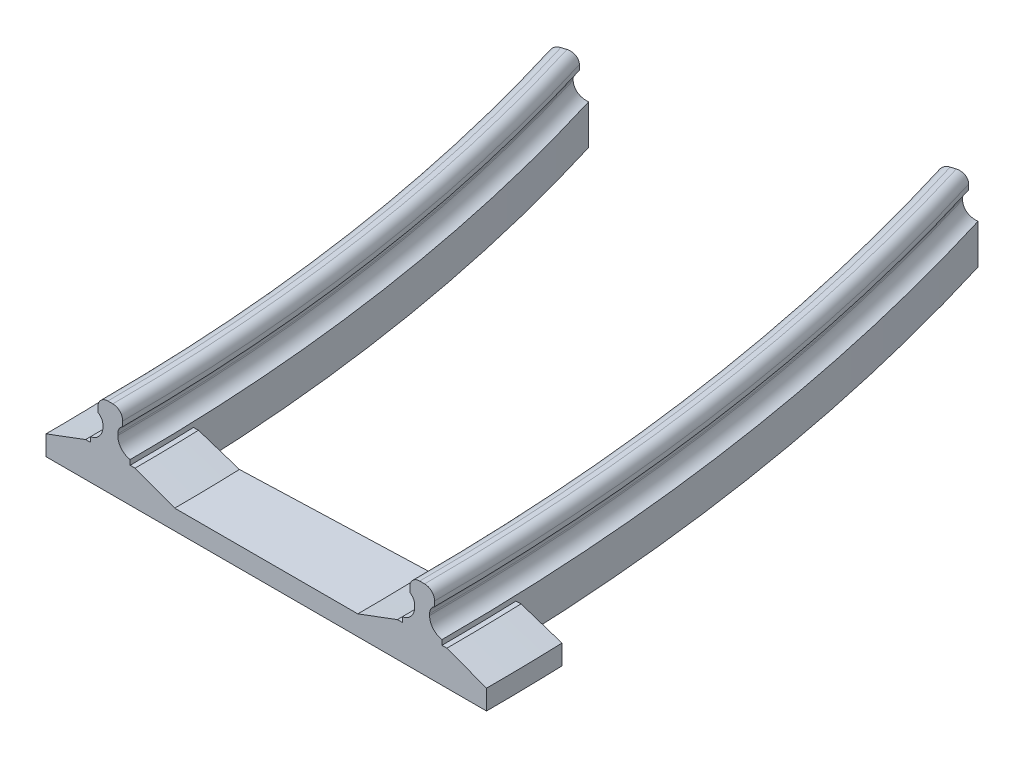
from build123d import *

# Parameters (mm, degrees)
SKETCH_1_W          = 4
SKETCH_1_H          = 21
SKETCH_1_H_2        = 8
EXTRUDE_1_DEPTH     = 4
SKETCH_1_7_W        = 44.5
SKETCH_1_7_H        = 8
EXTRUDE_2_DEPTH     = 3.5
SKETCH_2_W          = 18.5
SKETCH_2_H          = 1.5
CUT_EXTRUDE_1_DEPTH = 37.7704025
SKETCH_2_3_W        = 2.5
SKETCH_2_3_H        = 1.5
EXTRUDE_4_DEPTH     = 29
FILLET_1_R          = 1
FILLET_2_R          = 1.5
FILLET_3_R          = 1
REVOLVE_2_ANGLE     = 17
CUT_EXTRUDE_5_DEPTH = 70.125096927
REVOLVE_1_ANGLE     = 2


with BuildPart() as part:
    # 草图1 → 凸台-拉伸1 (new body)
    with BuildSketch(Plane(origin=(0, 0, 0), x_dir=(1, 0, 0), z_dir=(0, 1, 0))):
        with Locations((-15.75, -4)):
            Rectangle(SKETCH_1_W, SKETCH_1_H)
        with Locations((15.75, -4)):
            Rectangle(SKETCH_1_W, SKETCH_1_H)
        with Locations((15.75, 10.5)):
            Rectangle(SKETCH_1_W, SKETCH_1_H_2)
        with Locations((-15.75, 10.5)):
            Rectangle(SKETCH_1_W, SKETCH_1_H_2)
    extrude(amount=EXTRUDE_1_DEPTH)

    # 草图1<7> → 凸台-拉伸2 (add)
    with BuildSketch(Plane(origin=(0, 0, 0), x_dir=(1, 0, 0), z_dir=(0, 1, 0))):
        with Locations((0, 10.5)):
            Rectangle(SKETCH_1_7_W, SKETCH_1_7_H)
    extrude(amount=EXTRUDE_2_DEPTH)

    # 草图2 → 切除-拉伸1 (cut, through all)
    with BuildSketch(Plane(origin=(0, 0, -14.5), x_dir=(-1, 0, 0), z_dir=(0, 0, -1))):
        with Locations((0, 2.75)):
            Rectangle(SKETCH_2_W, SKETCH_2_H)
        Polygon((13.25, 3.5), (9.25, 3.5), (9.25, 2), align=None)
        Polygon((-9.25, 3.5), (-13.25, 3.5), (-9.25, 2), align=None)
        Polygon((-22.25, 3.5), (-22.25, 2), (-18.25, 3.5), align=None)
        Polygon((22.25, 3.5), (18.25, 3.5), (22.25, 2), align=None)
    extrude(amount=-CUT_EXTRUDE_1_DEPTH, mode=Mode.SUBTRACT)

    # 草图2<3> → 凸台-拉伸4 (add, through all)
    with BuildSketch(Plane(origin=(0, 0, -14.5), x_dir=(-1, 0, 0), z_dir=(0, 0, -1))):
        with Locations((-15.75, 7.25)):
            Rectangle(SKETCH_2_3_W, SKETCH_2_3_H)
        Polygon((-15, 6.5), (-16.5, 6.5), (-16.5, 4), (-15.75, 4), (-15, 4), align=None)
        with Locations((15.75, 7.25)):
            Rectangle(SKETCH_2_3_W, SKETCH_2_3_H)
        Polygon((16.5, 6.5), (15, 6.5), (15, 4), (15.75, 4), (16.5, 4), align=None)
    extrude(amount=-EXTRUDE_4_DEPTH)

    # 圆角1
    # the kernel refuses this fillet: 1 mm, written as the material it adds along each edge
    with BuildSketch(Plane(origin=(-16.5, 6.5, -14.5), x_dir=(-1, 0, 0), z_dir=(0, 0, 1)), Plane(origin=(15, 6.5, -14.5), x_dir=(-1, 0, 0), z_dir=(0, 0, 1))) as fillet_1_piece_1:
        with BuildLine():
            CenterArc((1, 0.866025404), FILLET_1_R, 180, 60)
            Line((0, 0.866025404), (-0.02, 0.866025404))
            Line((-0.02, 0.866025404), (-0.02, 0))
            Line((-0.02, 0), (0, -0.02))
            ThreePointArc((0, -0.02), (0.25, -0.02), (0.49, -0.017320508))
            Line((0.49, -0.017320508), (0.5, 0))
        make_face()
    extrude(amount=29)
    with BuildSketch(Plane(origin=(-15, 6.5, -14.5), x_dir=(0, -1, 0), z_dir=(0, 0, 1)), Plane(origin=(16.5, 6.5, -14.5), x_dir=(0, -1, 0), z_dir=(0, 0, 1))) as fillet_1_piece_2:
        with BuildLine():
            CenterArc((0.866025404, 1), FILLET_1_R, 210, 60)
            Line((0, 0.5), (-0.017320508, 0.49))
            ThreePointArc((-0.017320508, 0.49), (-0.02, 0.25), (-0.02, 0))
            Line((-0.02, 0), (0, -0.02))
            Line((0, -0.02), (0.866025404, -0.02))
            Line((0.866025404, -0.02), (0.866025404, 0))
        make_face()
    extrude(amount=29)

    # 圆角2
    # the kernel refuses this fillet: 1.5 mm, written as the material it adds along each edge
    with BuildSketch(Plane(origin=(16.5, 4, -14.5), x_dir=(1, 0, 0), z_dir=(0, 0, 1))) as fillet_2_piece_1:
        with BuildLine():
            CenterArc((1.5, 1.479019946), FILLET_2_R, 180, 80.405931773)
            Line((0, 1.479019946), (-0.03, 1.479019946))
            Line((-0.03, 1.479019946), (-0.03, 0))
            Line((-0.03, 0), (0, -0.03))
            ThreePointArc((0, -0.03), (0.625, -0.03), (1.245, -0.029580399))
            Line((1.245, -0.029580399), (1.25, 0))
        make_face()
    extrude(amount=29)
    with BuildSketch(Plane(origin=(15, 4, -14.5), x_dir=(0, 1, 0), z_dir=(0, 0, 1)), Plane(origin=(-16.5, 4, -14.5), x_dir=(0, 1, 0), z_dir=(0, 0, 1))) as fillet_2_piece_2:
        with BuildLine():
            CenterArc((1.479019946, 1.5), FILLET_2_R, 189.594068227, 80.405931773)
            Line((0, 1.25), (-0.029580399, 1.245))
            ThreePointArc((-0.029580399, 1.245), (-0.03, 0.625), (-0.03, 0))
            Line((-0.03, 0), (0, -0.03))
            Line((0, -0.03), (1.479019946, -0.03))
            Line((1.479019946, -0.03), (1.479019946, 0))
        make_face()
    extrude(amount=29)
    with BuildSketch(Plane(origin=(-15, 4, -14.5), x_dir=(0, 1, 0), z_dir=(0, 0, 1))) as fillet_2_piece_3:
        with BuildLine():
            CenterArc((1.479019946, -1.5), FILLET_2_R, 90, 80.405931773)
            Line((0, -1.25), (-0.029580399, -1.245))
            ThreePointArc((-0.029580399, -1.245), (-0.03, -0.625), (-0.03, 0))
            Line((-0.03, 0), (0, 0.03))
            Line((0, 0.03), (1.479019946, 0.03))
            Line((1.479019946, 0.03), (1.479019946, 0))
        make_face()
    extrude(amount=29)

    # 圆角3
    fillet_3_edges = [part.edges().sort_by_distance(p)[0] for p in [
        (14.5, 8, 0),
        (17, 8, 0),
        (-17, 8, 0),
        (-14.5, 8, 0),
    ]]
    fillet(fillet_3_edges, radius=FILLET_3_R)

    # 草图7 → 旋转2 (revolve)
    with BuildSketch(Plane(origin=(0, 0, -14.5), x_dir=(-1, 0, 0), z_dir=(0, 0, -1))):
        with BuildLine():
            Line((-17.75, 3.5), (-17.75, 0))
            Line((-17.75, 0), (-13.75, 0))
            Line((-13.75, 0), (-13.75, 3.5))
            Line((-13.75, 3.5), (-13.75, 4))
            ThreePointArc((-13.75, 4), (-14.645643924, 4.510774109), (-15, 5.479019946))
            Line((-15, 5.479019946), (-15, 5.633974596))
            ThreePointArc((-15, 5.633974596), (-14.866025404, 6.133974596), (-14.5, 6.5))
            Line((-14.5, 6.5), (-14.5, 7))
            ThreePointArc((-14.5, 7), (-14.792893219, 7.707106781), (-15.5, 8))
            Line((-15.5, 8), (-16, 8))
            ThreePointArc((-16, 8), (-16.707106781, 7.707106781), (-17, 7))
            Line((-17, 7), (-17, 6.5))
            ThreePointArc((-17, 6.5), (-16.633974596, 6.133974596), (-16.5, 5.633974596))
            Line((-16.5, 5.633974596), (-16.5, 5.479019946))
            ThreePointArc((-16.5, 5.479019946), (-16.854356076, 4.510774109), (-17.75, 4))
            Line((-17.75, 4), (-17.75, 3.5))
        make_face()
        with BuildLine():
            Line((13.75, 3.5), (13.75, 0))
            Line((13.75, 0), (17.75, 0))
            Line((17.75, 0), (17.75, 3.5))
            Line((17.75, 3.5), (17.75, 4))
            ThreePointArc((17.75, 4), (16.854356076, 4.510774109), (16.5, 5.479019946))
            Line((16.5, 5.479019946), (16.5, 5.633974596))
            ThreePointArc((16.5, 5.633974596), (16.633974596, 6.133974596), (17, 6.5))
            Line((17, 6.5), (17, 7))
            ThreePointArc((17, 7), (16.707106781, 7.707106781), (16, 8))
            Line((16, 8), (15.5, 8))
            ThreePointArc((15.5, 8), (14.792893219, 7.707106781), (14.5, 7))
            Line((14.5, 7), (14.5, 6.5))
            ThreePointArc((14.5, 6.5), (14.866025404, 6.133974596), (15, 5.633974596))
            Line((15, 5.633974596), (15, 5.479019946))
            ThreePointArc((15, 5.479019946), (14.645643924, 4.510774109), (13.75, 4))
            Line((13.75, 4), (13.75, 3.5))
        make_face()
    revolve(axis=Axis((-200, 10, -14.5), (0, 1, 0)), revolution_arc=REVOLVE_2_ANGLE)

    # 草图5<2> → 切除-拉伸5 (cut, through all)
    with BuildSketch(Plane(origin=(0, 0, -14.5), x_dir=(-1, 0, 0), z_dir=(0, 0, -1))):
        with BuildLine():
            Line((17, 6.5), (17, 7))
            ThreePointArc((17, 7), (16.707106781, 7.707106781), (16, 8))
            Line((16, 8), (15.5, 8))
            ThreePointArc((15.5, 8), (14.792893219, 7.707106781), (14.5, 7))
            Line((14.5, 7), (14.5, 6.5))
            ThreePointArc((14.5, 6.5), (14.866025404, 6.133974596), (15, 5.633974596))
            Line((15, 5.633974596), (15, 5.479019946))
            ThreePointArc((15, 5.479019946), (14.645643924, 4.510774109), (13.75, 4))
            Line((13.75, 4), (13.75, 3.5))
            Line((13.75, 3.5), (13.25, 3.5))
            Line((13.25, 3.5), (9.25, 2))
            Line((9.25, 2), (-9.25, 2))
            Line((-9.25, 2), (-13.25, 3.5))
            Line((-13.25, 3.5), (-13.75, 3.5))
            Line((-13.75, 3.5), (-13.75, 4))
            ThreePointArc((-13.75, 4), (-14.645643924, 4.510774109), (-15, 5.479019946))
            Line((-15, 5.479019946), (-15, 5.633974596))
            ThreePointArc((-15, 5.633974596), (-14.866025404, 6.133974596), (-14.5, 6.5))
            Line((-14.5, 6.5), (-14.5, 7))
            ThreePointArc((-14.5, 7), (-14.792893219, 7.707106781), (-15.5, 8))
            Line((-15.5, 8), (-16, 8))
            ThreePointArc((-16, 8), (-16.707106781, 7.707106781), (-17, 7))
            Line((-17, 7), (-17, 6.5))
            ThreePointArc((-17, 6.5), (-16.633974596, 6.133974596), (-16.5, 5.633974596))
            Line((-16.5, 5.633974596), (-16.5, 5.479019946))
            ThreePointArc((-16.5, 5.479019946), (-16.854356076, 4.510774109), (-17.75, 4))
            Line((-17.75, 4), (-17.75, 3.5))
            Line((-17.75, 3.5), (-18.25, 3.5))
            Line((-18.25, 3.5), (-22.25, 2))
            Line((-22.25, 2), (-22.25, 0))
            Line((-22.25, 0), (22.25, 0))
            Line((22.25, 0), (22.25, 2))
            Line((22.25, 2), (18.25, 3.5))
            Line((18.25, 3.5), (17.75, 3.5))
            Line((17.75, 3.5), (17.75, 4))
            ThreePointArc((17.75, 4), (16.854356076, 4.510774109), (16.5, 5.479019946))
            Line((16.5, 5.479019946), (16.5, 5.633974596))
            ThreePointArc((16.5, 5.633974596), (16.633974596, 6.133974596), (17, 6.5))
        make_face()
    extrude(amount=-CUT_EXTRUDE_5_DEPTH, mode=Mode.SUBTRACT)


with BuildPart() as cut_extrude_5_piece_1:
    # of the separate pieces the step leaves, piece 1, a body of its own (cut_extrude_5_pieces)
    add(part.part.solids().sort_by_distance((13.75, 0, -14.5))[0])



with BuildPart() as cut_extrude_5_piece_2:
    # of the separate pieces the step leaves, piece 2, a body of its own (cut_extrude_5_pieces)
    add(part.part.solids().sort_by_distance((-13.75, 4, -14.5))[0])


with BuildPart() as cut_extrude_5_piece_1_1:
    add(cut_extrude_5_piece_1.part)

    add(cut_extrude_5_piece_2.part)  # 旋转1 merges 切除-拉伸5 piece 2
    # 草图5 → 旋转1 (revolve)
    with BuildSketch(Plane(origin=(0, 0, -14.5), x_dir=(-1, 0, 0), z_dir=(0, 0, -1))):
        with BuildLine():
            Line((17, 6.5), (17, 7))
            ThreePointArc((17, 7), (16.707106781, 7.707106781), (16, 8))
            Line((16, 8), (15.5, 8))
            ThreePointArc((15.5, 8), (14.792893219, 7.707106781), (14.5, 7))
            Line((14.5, 7), (14.5, 6.5))
            ThreePointArc((14.5, 6.5), (14.866025404, 6.133974596), (15, 5.633974596))
            Line((15, 5.633974596), (15, 5.479019946))
            ThreePointArc((15, 5.479019946), (14.645643924, 4.510774109), (13.75, 4))
            Line((13.75, 4), (13.75, 3.5))
            Line((13.75, 3.5), (13.25, 3.5))
            Line((13.25, 3.5), (9.25, 2))
            Line((9.25, 2), (-9.25, 2))
            Line((-9.25, 2), (-13.25, 3.5))
            Line((-13.25, 3.5), (-13.75, 3.5))
            Line((-13.75, 3.5), (-13.75, 4))
            ThreePointArc((-13.75, 4), (-14.645643924, 4.510774109), (-15, 5.479019946))
            Line((-15, 5.479019946), (-15, 5.633974596))
            ThreePointArc((-15, 5.633974596), (-14.866025404, 6.133974596), (-14.5, 6.5))
            Line((-14.5, 6.5), (-14.5, 7))
            ThreePointArc((-14.5, 7), (-14.792893219, 7.707106781), (-15.5, 8))
            Line((-15.5, 8), (-16, 8))
            ThreePointArc((-16, 8), (-16.707106781, 7.707106781), (-17, 7))
            Line((-17, 7), (-17, 6.5))
            ThreePointArc((-17, 6.5), (-16.633974596, 6.133974596), (-16.5, 5.633974596))
            Line((-16.5, 5.633974596), (-16.5, 5.479019946))
            ThreePointArc((-16.5, 5.479019946), (-16.854356076, 4.510774109), (-17.75, 4))
            Line((-17.75, 4), (-17.75, 3.5))
            Line((-17.75, 3.5), (-18.25, 3.5))
            Line((-18.25, 3.5), (-22.25, 2))
            Line((-22.25, 2), (-22.25, 0))
            Line((-22.25, 0), (22.25, 0))
            Line((22.25, 0), (22.25, 2))
            Line((22.25, 2), (18.25, 3.5))
            Line((18.25, 3.5), (17.75, 3.5))
            Line((17.75, 3.5), (17.75, 4))
            ThreePointArc((17.75, 4), (16.854356076, 4.510774109), (16.5, 5.479019946))
            Line((16.5, 5.479019946), (16.5, 5.633974596))
            ThreePointArc((16.5, 5.633974596), (16.633974596, 6.133974596), (17, 6.5))
        make_face()
    revolve(axis=Axis((-200, 10, -14.5), (0, 1, 0)), revolution_arc=REVOLVE_1_ANGLE)


solid = cut_extrude_5_piece_1_1.part
